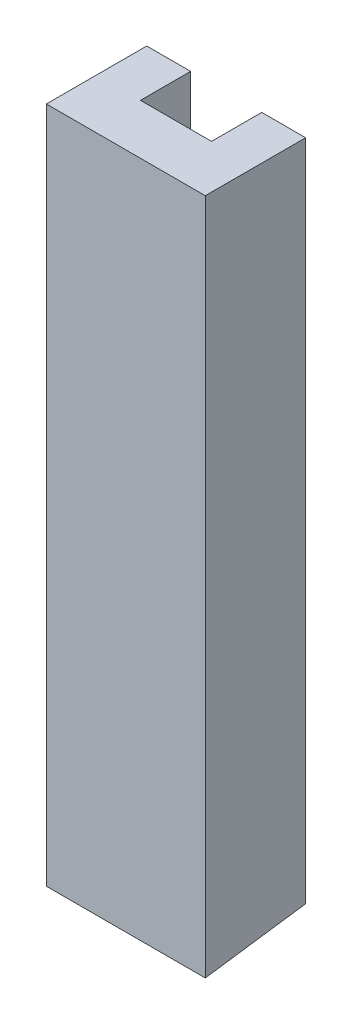
from build123d import *

# Parameters (mm, degrees)
SKETCH1_W           = 19
SKETCH1_H           = 81
BOSS_EXTRUDE1_DEPTH = 12
SKETCH2_W           = 8.5
SKETCH2_H           = 81
CUT_EXTRUDE1_DEPTH  = 6
SKETCH3_W           = 31.784398885
SKETCH3_H           = 20.084620154
CUT_EXTRUDE2_DEPTH  = 82.42011902


with BuildPart() as part:
    # Sketch1 → Boss-Extrude1 (new body)
    with BuildSketch(Plane.XY):
        with Locations((-0.214285714, -27.308823529)):
            Rectangle(SKETCH1_W, SKETCH1_H)
    extrude(amount=BOSS_EXTRUDE1_DEPTH)

    # Sketch2 → Cut-Extrude1 (cut)
    with BuildSketch(Plane(origin=(0, 0, 0), x_dir=(-1, 0, 0), z_dir=(0, 0, -1))):
        with Locations((0.214285714, -27.308823529)):
            Rectangle(SKETCH2_W, SKETCH2_H)
    extrude(amount=-CUT_EXTRUDE1_DEPTH, mode=Mode.SUBTRACT)

    # Sketch3 → Cut-Extrude2 (cut, through all)
    with BuildSketch(Plane(origin=(0, -64.841599983, -9.112892585), x_dir=(1, 0, 0), z_dir=(0, -0.9902680687415703, -0.13917310096006574))):
        with Locations((-0.737280551, 17.487835558)):
            Rectangle(SKETCH3_W, SKETCH3_H)
    extrude(amount=CUT_EXTRUDE2_DEPTH, mode=Mode.SUBTRACT)


solid = part.part
